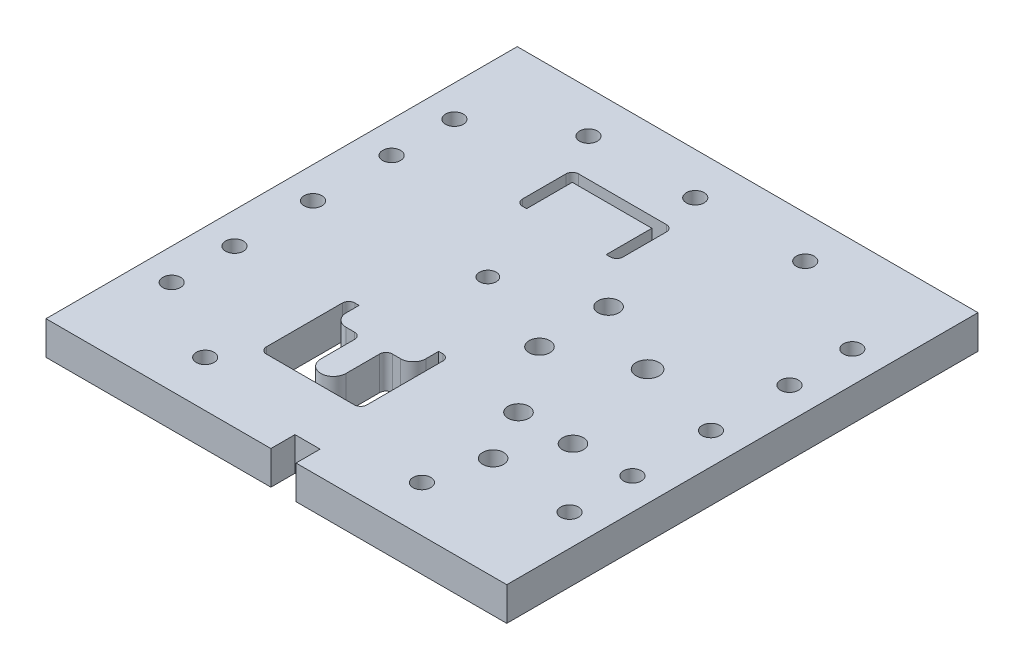
from build123d import *

# Parameters (mm, degrees)
SKETCH1_W              = 220
SKETCH1_H              = 225
BOSS_EXTRUDE1_DEPTH    = 16
CUT_EXTRUDE1_REACH     = 160.153
SKETCH2_R              = 4
CUT_EXTRUDE2_REACH     = 160.153
SKETCH3_W              = 12
SKETCH3_H              = 11.5
SKETCH4_R              = 8.5
CUT_EXTRUDE3_DEPTH     = 5
M10_TAPPED_HOLE2_D     = 8.5
M10_TAPPED_HOLE3_D     = 8.5
M10_TAPPED_HOLE4_D     = 8.5
CUT_EXTRUDE4_REACH     = 160.153
CUT_EXTRUDE6_REACH     = 160.153
F_10_0MM_DOWEL_HOLE1_D = 10
CUT_EXTRUDE7_REACH     = 160.153
SKETCH34_R             = 5


with BuildPart() as part:
    # Sketch1 → Boss-Extrude1 (new body)
    with BuildSketch(Plane(origin=(0, 0, 0), x_dir=(1, 0, 0), z_dir=(0, 1, 0))):
        Rectangle(SKETCH1_W, SKETCH1_H)
    extrude(amount=-BOSS_EXTRUDE1_DEPTH)

    # Sketch2 → Cut-Extrude1 (cut, up to next)
    with BuildSketch(Plane(origin=(0, 0, 0), x_dir=(1, 0, 0), z_dir=(0, 1, 0)), mode=Mode.PRIVATE) as cut_extrude1_sk1:
        with Locations((-21.75, 10.23)):
            Circle(SKETCH2_R)
    cut_extrude1_tool1 = extrude(cut_extrude1_sk1.sketch, amount=-CUT_EXTRUDE1_REACH, mode=Mode.PRIVATE) & part.part
    add(cut_extrude1_tool1.solids().sort_by_distance((-21.75, 0, -10.23))[0], mode=Mode.SUBTRACT)

    # Sketch3 → Cut-Extrude2 (cut, up to next)
    with BuildSketch(Plane.XZ.offset(16), mode=Mode.PRIVATE) as cut_extrude2_sk1:
        with Locations((3.38, 106.75)):
            Rectangle(SKETCH3_W, SKETCH3_H)
    cut_extrude2_tool1 = extrude(cut_extrude2_sk1.sketch, amount=-CUT_EXTRUDE2_REACH, mode=Mode.PRIVATE) & part.part
    add(cut_extrude2_tool1.solids().sort_by_distance((3.38, -16, 106.75))[0], mode=Mode.SUBTRACT)

    # Sketch4 → Cut-Extrude3 (cut)
    with BuildSketch(Plane.XZ.offset(16)):
        with Locations((-21.75, 100)):
            Circle(SKETCH4_R)
        with Locations((25, 100)):
            Circle(SKETCH4_R)
        with Locations((70, 100)):
            Circle(SKETCH4_R)
        with Locations((-21.75, -100)):
            Circle(SKETCH4_R)
        with Locations((25, -100)):
            Circle(SKETCH4_R)
        with Locations((70, -100)):
            Circle(SKETCH4_R)
        with Locations((-98, 100)):
            Circle(SKETCH4_R)
        with Locations((-98, -100)):
            Circle(SKETCH4_R)
    extrude(amount=-CUT_EXTRUDE3_DEPTH, mode=Mode.SUBTRACT)

    # M10 Tapped Hole2 (through all)
    with Locations(Plane(origin=(0, 0, 0), x_dir=(1, 0, 0), z_dir=(0, 1, 0))):
        with Locations((-95, -67.5), (-95, -37.5), (-95, 0), (-95, 37.5), (-95, 67.5), (95, 67.5), (95, 37.5), (95, 0), (95, -37.5), (95, -67.5)):
            Hole(M10_TAPPED_HOLE2_D / 2)

    # M10 Tapped Hole3 (through all)
    with Locations(Plane(origin=(0, 0, 0), x_dir=(1, 0, 0), z_dir=(0, 1, 0))):
        with Locations((-56, 92.5), (-5, 92.5), (47.5, 92.5)):
            Hole(M10_TAPPED_HOLE3_D / 2)

    # M10 Tapped Hole4 (through all)
    with Locations(Plane(origin=(0, 0, 0), x_dir=(1, 0, 0), z_dir=(0, 1, 0))):
        with Locations((47.5, -90.5), (-56, -90.5)):
            Hole(M10_TAPPED_HOLE4_D / 2)

    # Sketch24 → Cut-Extrude4 (cut, up to next)
    with BuildSketch(Plane(origin=(0, 0, 0), x_dir=(1, 0, 0), z_dir=(0, 1, 0)), mode=Mode.PRIVATE) as cut_extrude4_sk1:
        with BuildLine():
            Line((2.25, -35.27), (2.25, -71.53))
            ThreePointArc((2.25, -71.53), (1.371320344, -73.651320344), (-0.75, -74.53))
            Line((-0.75, -74.53), (-42.75, -74.53))
            ThreePointArc((-42.75, -74.53), (-44.871320344, -73.651320344), (-45.75, -71.53))
            Line((-45.75, -71.53), (-45.75, -35.27))
            ThreePointArc((-45.75, -35.27), (-44.871320344, -33.148679656), (-42.75, -32.27))
            Line((-42.75, -32.27), (-40.75, -32.27))
            Line((-40.75, -32.27), (-40.75, -38.4))
            ThreePointArc((-40.75, -38.4), (-38.992640687, -42.642640687), (-34.75, -44.4))
            Line((-34.75, -44.4), (-30.75, -44.4))
            ThreePointArc((-30.75, -44.4), (-28.628679656, -45.278679656), (-27.75, -47.4))
            Line((-27.75, -47.4), (-27.75, -63.53))
            ThreePointArc((-27.75, -63.53), (-21.75, -69.53), (-15.75, -63.53))
            Line((-15.75, -63.53), (-15.75, -47.4))
            ThreePointArc((-15.75, -47.4), (-14.871320344, -45.278679656), (-12.75, -44.4))
            Line((-12.75, -44.4), (-8.75, -44.4))
            ThreePointArc((-8.75, -44.4), (-4.507359313, -42.642640687), (-2.75, -38.4))
            Line((-2.75, -38.4), (-2.75, -32.27))
            Line((-2.75, -32.27), (-0.75, -32.27))
            ThreePointArc((-0.75, -32.27), (1.371320344, -33.148679656), (2.25, -35.27))
        make_face()
    cut_extrude4_tool1 = extrude(cut_extrude4_sk1.sketch, amount=-CUT_EXTRUDE4_REACH, mode=Mode.PRIVATE) & part.part
    add(cut_extrude4_tool1.solids().sort_by_distance((-21.75, 0, 70.169524))[0], mode=Mode.SUBTRACT)

    # Sketch29 → Cut-Extrude6 (cut, up to next)
    with BuildSketch(Plane.XZ.offset(16), mode=Mode.PRIVATE) as cut_extrude6_sk1:
        with BuildLine():
            Line((-2.75, -47.73), (-0.75, -47.73))
            ThreePointArc((-0.75, -47.73), (1.371320344, -48.608679656), (2.25, -50.73))
            Line((2.25, -50.73), (2.25, -71.53))
            ThreePointArc((2.25, -71.53), (1.371320344, -73.651320344), (-0.75, -74.53))
            Line((-0.75, -74.53), (-42.75, -74.53))
            ThreePointArc((-42.75, -74.53), (-44.871320344, -73.651320344), (-45.75, -71.53))
            Line((-45.75, -71.53), (-45.75, -50.73))
            ThreePointArc((-45.75, -50.73), (-44.871320344, -48.608679656), (-42.75, -47.73))
            Line((-42.75, -47.73), (-40.75, -47.73))
            Line((-40.75, -47.73), (-40.75, -69.53))
            Line((-40.75, -69.53), (-2.75, -69.53))
            Line((-2.75, -69.53), (-2.75, -47.73))
        make_face()
    cut_extrude6_tool1 = extrude(cut_extrude6_sk1.sketch, amount=-CUT_EXTRUDE6_REACH, mode=Mode.PRIVATE) & part.part
    add(cut_extrude6_tool1.solids().sort_by_distance((-1.75, -16, -48.279749))[0], mode=Mode.SUBTRACT)

    # Ø10.0mm Dowel Hole1 (through all)
    with Locations(Plane(origin=(0, 0, 0), x_dir=(1, 0, 0), z_dir=(0, 1, 0))):
        with Locations((54.5, -63.53), (67.5, -38.4), (41.5, -38.4), (19.38, 26.73), (19.38, -6.27)):
            Hole(F_10_0MM_DOWEL_HOLE1_D / 2)

    # Sketch34 → Cut-Extrude7 (cut, up to next)
    with BuildSketch(Plane(origin=(0, 0, 0), x_dir=(1, 0, 0), z_dir=(0, 1, 0)), mode=Mode.PRIVATE) as cut_extrude7_sk1:
        with Locations((54.5, 10.23)):
            Circle(SKETCH34_R)
    cut_extrude7_tool1 = extrude(cut_extrude7_sk1.sketch, amount=-CUT_EXTRUDE7_REACH, mode=Mode.PRIVATE) & part.part
    add(cut_extrude7_tool1.solids().sort_by_distance((54.5, 0, -10.23))[0], mode=Mode.SUBTRACT)

    # Cut-Sweep1: sweep along a curve in space
    with BuildLine() as cut_sweep1_path:
        ThreePointArc((54.5, 0, -5.23), (58.035533906, 0, -6.694466094), (59.5, 0, -10.23))
        ThreePointArc((59.5, 0, -10.23), (58.035533906, 0, -13.765533906), (54.5, 0, -15.23))
        ThreePointArc((54.5, 0, -15.23), (50.964466094, 0, -13.765533906), (49.5, 0, -10.23))
        ThreePointArc((49.5, 0, -10.23), (50.964466094, 0, -6.694466094), (54.5, 0, -5.23))
    # Sketch35 → Cut-Sweep1 (sweep, cut)
    with BuildSketch(Plane.XY.offset(-10.23)):
        Polygon((59.5, -10), (60.024077793, 0), (59.5, 0), align=None)
    sweep(path=cut_sweep1_path.line, mode=Mode.SUBTRACT)


solid = part.part
